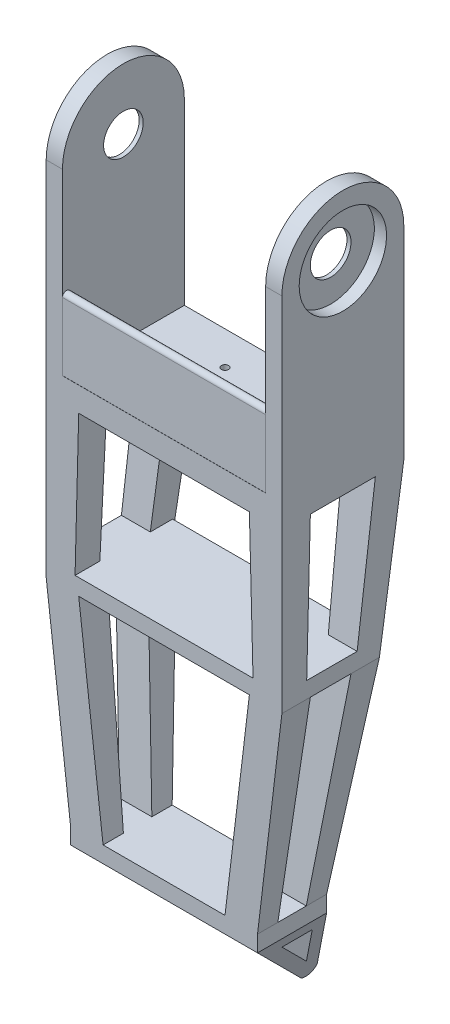
from build123d import *

# Parameters (mm, degrees)
BOSS_EXTRUDE1_DEPTH      = 4
BOSS_EXTRUDE1_DEPTH_BACK = 2
SKETCH2_W                = 50
SKETCH2_H                = 30
SKETCH3_R                = 10.75
BOSS_EXTRUDE2_DEPTH      = 4
SKETCH4_R                = 10.75
SKETCH4_R_2              = 6.25
BOSS_EXTRUDE3_DEPTH      = 1
SKETCH5_R                = 6.25
SKETCH5_R_2              = 5.01
BOSS_EXTRUDE4_DEPTH      = 1
BOSS_EXTRUDE5_START      = -1
SKETCH6_R                = 6.25
SKETCH6_R_2              = 4.875
BOSS_EXTRUDE5_DEPTH      = 1
SKETCH8_R                = 0.875
CUT_EXTRUDE1_DEPTH       = 10
SKETCH9_W                = 58
SKETCH9_H                = 24
BOSS_EXTRUDE6_DEPTH      = 4
SKETCH15_W               = 46
SKETCH15_H               = 17
BOSS_EXTRUDE7_DEPTH      = 4
BOSS_EXTRUDE8_DEPTH      = 46
SKETCH18_W               = 91.307129758
SKETCH18_H               = 96.091784827
CUT_EXTRUDE3_DEPTH       = 21
FILLET1_R                = 2
BOSS_EXTRUDE9_START      = -4
BOSS_EXTRUDE9_DEPTH      = 50
FILLET3_R                = 1
FILLET4_R                = 1


with BuildPart() as part:
    # Sketch2 → Boss-Extrude1 (new, two sides: drawn at the far end of the back side and taken through both)
    with BuildSketch(Plane(origin=(0, 0, 0), x_dir=(1, 0, 0), z_dir=(0, 1, 0)).offset(-BOSS_EXTRUDE1_DEPTH_BACK)):
        Rectangle(SKETCH2_W, SKETCH2_H)
    extrude(amount=BOSS_EXTRUDE1_DEPTH + BOSS_EXTRUDE1_DEPTH_BACK)

    # Sketch3 → Boss-Extrude2 (add)
    with BuildSketch(Plane.ZY.offset(25)):
        with BuildLine():
            Line((-15, -2), (-15, 48))
            ThreePointArc((-15, 48), (0, 63), (15, 48))
            Line((15, 48), (15, -2))
            Line((15, -2), (-15, -2))
        make_face()
        with Locations((0, 48)):
            Circle(SKETCH3_R, mode=Mode.SUBTRACT)
    boss_extrude2 = extrude(amount=BOSS_EXTRUDE2_DEPTH)

    # Mirror1: Boss-Extrude2 across plane
    add(boss_extrude2.mirror(Plane(origin=(0, 0, 0), x_dir=(0, 0, 1), z_dir=(1, 0, 0))))

    # Sketch4 → Boss-Extrude3 (add)
    with BuildSketch(Plane(origin=(-25, 0, 0), x_dir=(0, 0, -1), z_dir=(1, 0, 0))):
        with Locations((0, 48)):
            Circle(SKETCH4_R)
        with Locations((0, 48)):
            Circle(SKETCH4_R_2, mode=Mode.SUBTRACT)
    boss_extrude3 = extrude(amount=-BOSS_EXTRUDE3_DEPTH)

    # Mirror2: Boss-Extrude3 across plane
    add(boss_extrude3.mirror(Plane(origin=(0, 0, 0), x_dir=(0, 0, 1), z_dir=(1, 0, 0))))

    # Sketch5 → Boss-Extrude4 (add)
    with BuildSketch(Plane(origin=(26, 0, 0), x_dir=(0, 0, -1), z_dir=(1, 0, 0))):
        with Locations((0, 48)):
            Circle(SKETCH5_R)
        with Locations((0, 48)):
            Circle(SKETCH5_R_2, mode=Mode.SUBTRACT)
    extrude(amount=-BOSS_EXTRUDE4_DEPTH)

    # Sketch6 → Boss-Extrude5 (add)
    with BuildSketch(Plane.ZY.offset(26).offset(BOSS_EXTRUDE5_START)):
        with Locations((0, 48)):
            Circle(SKETCH6_R)
        with Locations((0, 48)):
            Circle(SKETCH6_R_2, mode=Mode.SUBTRACT)
    extrude(amount=BOSS_EXTRUDE5_DEPTH)

    # Sketch8 → Cut-Extrude1 (cut)
    with BuildSketch(Plane.XZ.offset(2)):
        with Locations(Location((-6.75, 6.75, 0), (0, 0, 270))):
            Circle(SKETCH8_R)
        with Locations(Location((6.75, 6.75, 0), (0, 0, 270))):
            Circle(SKETCH8_R)
        with Locations(Location((6.75, -6.75, 0), (0, 0, 270))):
            Circle(SKETCH8_R)
        with Locations(Location((-6.75, -6.75, 0), (0, 0, 270))):
            Circle(SKETCH8_R)
    extrude(amount=-CUT_EXTRUDE1_DEPTH, mode=Mode.SUBTRACT)



with BuildPart() as body_2:
    # Sketch9 → Boss-Extrude6 (new body)
    with BuildSketch(Plane(origin=(0, -37, 0), x_dir=(-1, 0, 0), z_dir=(0, -1, 0))):
        with Locations((0, -3)):
            Rectangle(SKETCH9_W, SKETCH9_H)
    extrude(amount=BOSS_EXTRUDE6_DEPTH)


with BuildPart() as part_1:
    add(part.part)

    add(body_2.part)  # Loft3 merges body 2
    # Sketch11 → Loft3 section 0
    with BuildSketch(Plane.XZ.offset(2)):
        with BuildLine():
            Line((-29, -15), (-21, -15))
            Line((-21, -15), (-21, -8))
            Line((-21, -8), (-29, -8))
            Line((-29, -8), (-29, -15))
        make_face()
    # Sketch10 → Loft3 section 1
    with BuildSketch(Plane.XZ.offset(41)):
        with BuildLine():
            Line((-29, -9), (-22, -9))
            Line((-22, -9), (-22, -3))
            Line((-22, -3), (-29, -3))
            Line((-29, -3), (-29, -9))
        make_face()
    loft()

    # Sketch11<6> → Loft4 section 0
    with BuildSketch(Plane.XZ.offset(2)):
        with BuildLine():
            Line((-29, 15), (-21, 15))
            Line((-21, 15), (-21, 8))
            Line((-21, 8), (-29, 8))
            Line((-29, 8), (-29, 15))
        make_face()
    # Sketch10<6> → Loft4 section 1
    with BuildSketch(Plane.XZ.offset(41)):
        with BuildLine():
            Line((-29, 15), (-22, 15))
            Line((-22, 15), (-22, 9))
            Line((-22, 9), (-29, 9))
            Line((-29, 9), (-29, 15))
        make_face()
    loft()

    # Sketch11<7> → Loft5 section 0
    with BuildSketch(Plane.XZ.offset(2)):
        with BuildLine():
            Line((29, 15), (21, 15))
            Line((21, 15), (21, 8))
            Line((21, 8), (29, 8))
            Line((29, 8), (29, 15))
        make_face()
    # Sketch10<7> → Loft5 section 1
    with BuildSketch(Plane.XZ.offset(41)):
        with BuildLine():
            Line((29, 15), (22, 15))
            Line((22, 15), (22, 9))
            Line((22, 9), (29, 9))
            Line((29, 9), (29, 15))
        make_face()
    loft()

    # Sketch11<8> → Loft6 section 0
    with BuildSketch(Plane.XZ.offset(2)):
        with BuildLine():
            Line((29, -15), (21, -15))
            Line((21, -15), (21, -8))
            Line((21, -8), (29, -8))
            Line((29, -8), (29, -15))
        make_face()
    # Sketch10<8> → Loft6 section 1
    with BuildSketch(Plane.XZ.offset(41)):
        with BuildLine():
            Line((29, -9), (22, -9))
            Line((22, -9), (22, -3))
            Line((22, -3), (29, -3))
            Line((29, -3), (29, -9))
        make_face()
    loft()

    # Sketch14 → Loft7 section 0
    with BuildSketch(Plane.XZ.offset(41)):
        with BuildLine():
            Line((-29, -9), (-21, -9))
            Line((-21, -9), (-21, -2))
            Line((-21, -2), (-29, -2))
            Line((-29, -2), (-29, -9))
        make_face()
    # Sketch13 → Loft7 section 1
    with BuildSketch(Plane(origin=(0, -91, 0), x_dir=(-1, 0, 0), z_dir=(0, -1, 0))):
        with BuildLine():
            Line((23, 2), (15, 2))
            Line((15, 2), (15, -3))
            Line((15, -3), (23, -3))
            Line((23, -3), (23, 2))
        make_face()
    loft()

    # Loft8: read off the stored shape, not the designer's step
    # Loft8: loft between two sections, ruled curve by curve
    loft8_from = [
        Edge.make_line((21, -41, -2), (29, -41, -2)),
        Edge.make_line((29, -41, -2), (29, -41, -9)),
        Edge.make_line((21, -41, -9), (21, -41, -2)),
        Edge.make_line((21, -41, -9), (29, -41, -9)),
    ]
    loft8_to = [
        Edge.make_line((15, -91, 3), (23, -91, 3)),
        Edge.make_line((23, -91, 3), (23, -91, -2)),
        Edge.make_line((15, -91, -2), (15, -91, 3)),
        Edge.make_line((15, -91, -2), (23, -91, -2)),
    ]
    loft8 = Solid(Shell([*[Face.make_surface_from_curves(loft8_from[k], loft8_to[k]) for k in range(4)], Face(Wire(loft8_from)), Face(Wire(loft8_to))]))
    add(loft8)

    # Loft9: read off the stored shape, not the designer's step
    # Loft9: loft between two sections, ruled curve by curve
    loft9_from = [
        Edge.make_line((29, -41, 15), (29, -41, 8)),
        Edge.make_line((21, -41, 8), (21, -41, 15)),
        Edge.make_line((29, -41, 8), (21, -41, 8)),
        Edge.make_line((21, -41, 15), (29, -41, 15)),
    ]
    loft9_to = [
        Edge.make_line((23, -91, 15), (23, -91, 10)),
        Edge.make_line((15, -91, 10), (15, -91, 15)),
        Edge.make_line((23, -91, 10), (15, -91, 10)),
        Edge.make_line((15, -91, 15), (23, -91, 15)),
    ]
    loft9 = Solid(Shell([*[Face.make_surface_from_curves(loft9_from[k], loft9_to[k]) for k in range(4)], Face(Wire(loft9_from)), Face(Wire(loft9_to))]))
    add(loft9)

    # Loft10: read off the stored shape, not the designer's step
    # Loft10: loft between two sections, ruled curve by curve
    loft10_from = [
        Edge.make_line((-21, -41, 15), (-21, -41, 8)),
        Edge.make_line((-29, -41, 8), (-29, -41, 15)),
        Edge.make_line((-21, -41, 8), (-29, -41, 8)),
        Edge.make_line((-29, -41, 15), (-21, -41, 15)),
    ]
    loft10_to = [
        Edge.make_line((-15, -91, 15), (-15, -91, 10)),
        Edge.make_line((-23, -91, 10), (-23, -91, 15)),
        Edge.make_line((-15, -91, 10), (-23, -91, 10)),
        Edge.make_line((-23, -91, 15), (-15, -91, 15)),
    ]
    loft10 = Solid(Shell([*[Face.make_surface_from_curves(loft10_from[k], loft10_to[k]) for k in range(4)], Face(Wire(loft10_from)), Face(Wire(loft10_to))]))
    add(loft10)

    # Sketch15 → Boss-Extrude7 (add)
    with BuildSketch(Plane.XZ.offset(91)):
        with Locations((0, 6.5)):
            Rectangle(SKETCH15_W, SKETCH15_H)
    extrude(amount=BOSS_EXTRUDE7_DEPTH)

    # Sketch16 → Boss-Extrude8 (add)
    with BuildSketch(Plane.ZY.offset(23)):
        Polygon((15, -95), (-2, -95), (-8.222431864, -118.222431864), align=None)
        Polygon((-2.426876907, -108.184236219), (0.301980964, -98), (7.757359313, -98), align=None, mode=Mode.SUBTRACT)
    extrude(amount=-BOSS_EXTRUDE8_DEPTH)

    # Sketch18 → Cut-Extrude3 (cut)
    with BuildSketch(Plane(origin=(-52.994526892, -21.679383469, 0), x_dir=(0, 0, -1), z_dir=(0.9255481540620362, 0.37862991761396436, 0))):
        with Locations((11.5562698, -126.796989603)):
            Rectangle(SKETCH18_W, SKETCH18_H)
    cut_extrude3 = extrude(amount=-CUT_EXTRUDE3_DEPTH, mode=Mode.SUBTRACT)

    # Mirror3: Cut-Extrude3 across plane
    add(cut_extrude3.mirror(Plane.ZY), mode=Mode.SUBTRACT)

    # Fillet1
    fillet1_edges = [part_1.edges().sort_by_distance(p)[0] for p in [
        (0, -118.222431864, -8.222431864),
    ]]
    fillet(fillet1_edges, radius=FILLET1_R)

    # Sketch22 → Boss-Extrude9 (add)
    with BuildSketch(Plane.ZY.offset(29).offset(BOSS_EXTRUDE9_START)):
        Polygon((14.968137022, 3.610533067), (9.468137022, 3.610533067), (4.968137022, 3.610533067), (15, 25.228846085), (14.968137022, 3.960925502), align=None)
    extrude(amount=-BOSS_EXTRUDE9_DEPTH)

    # Fillet3
    fillet3_edges = [part_1.edges().sort_by_distance(p)[0] for p in [
        (0, 4, 5.148867077),
    ]]
    fillet(fillet3_edges, radius=FILLET3_R)

    # Fillet4
    fillet4_edges = [part_1.edges().sort_by_distance(p)[0] for p in [
        (0, 25.228846085, 15),
    ]]
    fillet(fillet4_edges, radius=FILLET4_R)


solid = part_1.part
